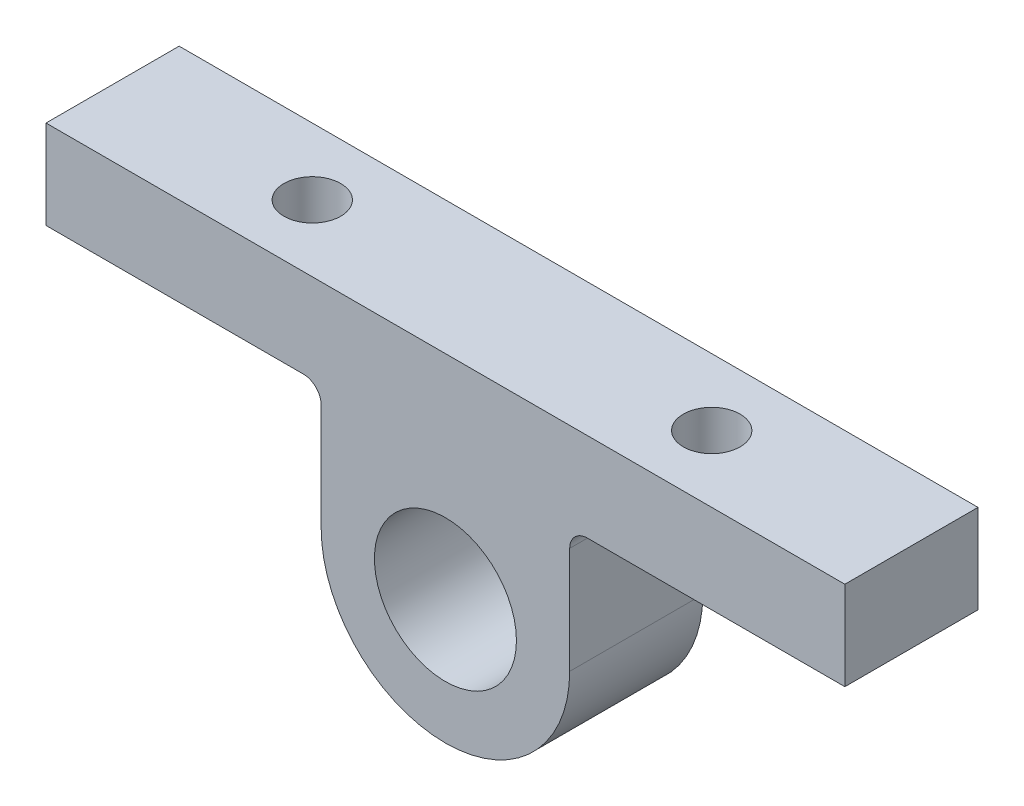
from build123d import *

# Parameters (mm, degrees)
CROQUIS1_R                       = 8
SALIENTE_EXTRUIR1_DEPTH          = 7.5
TALADRO_DE_MARGEN_PARA_M61_D     = 6.4
TALADRO_DE_MARGEN_PARA_M61_DEPTH = 20
TALADRO_DE_MARGEN_PARA_M61_TIP   = 1.922753981
REDONDEO1_R                      = 2


with BuildPart() as part:
    # Croquis1 → Saliente-Extruir1 (new, symmetric)
    with BuildSketch(Plane.XY):
        with BuildLine():
            Line((-14, 14), (-14, 0))
            ThreePointArc((-14, 0), (0, -14), (14, 0))
            Line((14, 0), (14, 14))
            Line((14, 14), (45, 14))
            Line((45, 14), (45, 24))
            Line((45, 24), (-45, 24))
            Line((-45, 24), (-45, 14))
            Line((-45, 14), (-14, 14))
        make_face()
        Circle(CROQUIS1_R, mode=Mode.SUBTRACT)
    extrude(amount=SALIENTE_EXTRUIR1_DEPTH, both=True)

    # Taladro de margen para M61
    with Locations(Plane(origin=(0, 14, 0), x_dir=(-1, 0, 0), z_dir=(0, -1, 0))):
        with Locations((22.5, 0), (-22.5, 0)):
            Hole(TALADRO_DE_MARGEN_PARA_M61_D / 2, depth=TALADRO_DE_MARGEN_PARA_M61_DEPTH)
            with Locations((0, 0, -(TALADRO_DE_MARGEN_PARA_M61_DEPTH + TALADRO_DE_MARGEN_PARA_M61_TIP / 2))):  # 118° drill point
                Cone(0, TALADRO_DE_MARGEN_PARA_M61_D / 2, TALADRO_DE_MARGEN_PARA_M61_TIP, mode=Mode.SUBTRACT)

    # Redondeo1
    redondeo1_edges = [part.edges().sort_by_distance(p)[0] for p in [
        (-14, 14, 0),
        (14, 14, 0),
    ]]
    fillet(redondeo1_edges, radius=REDONDEO1_R)


solid = part.part
